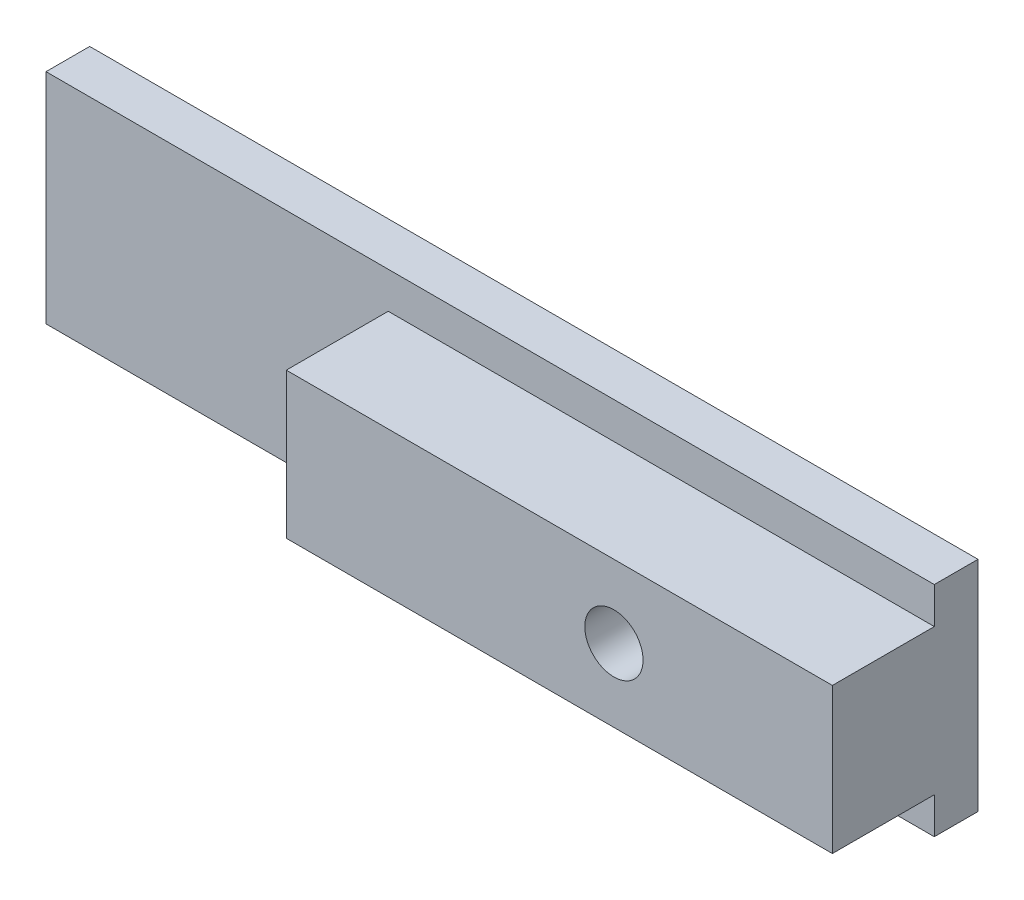
from build123d import *

# Parameters (mm, degrees)
ESTRUSIONE_ESTRUSIONE1_DEPTH = 6
ESTRUSIONE_ESTRUSIONE2_DEPTH = 14
SCHIZZO3_R                   = 3.999999999999999
TAGLIO_ESTRUSIONE1_DEPTH     = 9
FILETTATURA2_PITCH           = 1


with BuildPart() as part:
    # Schizzo1 → Estrusione-Estrusione1 (new body)
    with BuildSketch(Plane.XY):
        Polygon((61, -14.999999999999991), (-61, -15.000000000000005), (-61, 14.999999999999995), (61, 15.000000000000009), align=None)
    extrude(amount=ESTRUSIONE_ESTRUSIONE1_DEPTH)

    # Schizzo2 → Estrusione-Estrusione2 (add)
    with BuildSketch(Plane.XY.offset(6)):
        Polygon((-14.000000000000012, 9.999999999999932), (60.999999999999986, 10.000000000000002), (60.99999999999999, -10.000000000000002), (-14.000000000000012, -9.99999999999998), align=None)
    extrude(amount=ESTRUSIONE_ESTRUSIONE2_DEPTH)

    # Schizzo3 → Taglio-Estrusione1 (cut)
    with BuildSketch(Plane.XY.offset(20)):
        with Locations((30.999999999999993, -3.67e-15)):
            Circle(SCHIZZO3_R)
    extrude(amount=-TAGLIO_ESTRUSIONE1_DEPTH, mode=Mode.SUBTRACT)

    # Schizzo8 → Foro per Vite M8-2 (revolve, cut)
    with BuildSketch(Plane(origin=(30.999999999999993, -3.67e-15, 11.000000000000002), x_dir=(0, -1, 0), z_dir=(1, 0, 0))):
        Polygon((0, 0), (-2.69e-15, 11.000000000000002), (4.2, 11.000000000000002), (4.199999999999989, -1.04e-15), align=None)
    revolve(axis=Axis((30.999999999999993, -3.67e-15, 17.349999999999994), (0, 0, -1)), mode=Mode.SUBTRACT)

    # Filettatura2: the profile of Profilo filettatura2 profile screwed along a right-hand helix of 11 turns, 8 arcs to a turn; built about Z, then put on its axis
    filettatura2_z = Axis((0, 0, 0), (0, 0, 1))
    filettatura2_corners = [(4.1997, 0, -0.000173205), (4.741265875, 0, 0.312499999), (4.741265875, 0, 0.437499999), (4.1997, 0, 0.750173202)]
    with BuildLine(mode=Mode.PRIVATE) as filettatura2_profile:
        Line(filettatura2_corners[0], filettatura2_corners[1])
        Line(filettatura2_corners[1], filettatura2_corners[2])
        Line(filettatura2_corners[2], filettatura2_corners[3])
        Line(filettatura2_corners[3], filettatura2_corners[0])
    filettatura2_cap = Face(filettatura2_profile.wire())
    filettatura2_turn_angles = [0, 22.5, 45, 67.5, 90, 112.5, 135, 157.5, 180, 202.5, 225, 247.5, 270, 292.5, 315, 337.5, 360]
    filettatura2_turn_weights = [1, 0.9238795325112867, 1, 0.9238795325112867, 1, 0.9238795325112867, 1, 0.9238795325112867, 1, 0.9238795325112867, 1, 0.9238795325112867, 1, 0.9238795325112867, 1, 0.9238795325112867, 1]
    filettatura2_turn_rails = [Edge.make_bspline([Vector(p[0], p[1], 0).rotate(filettatura2_z, filettatura2_turn_angles[k]) / filettatura2_turn_weights[k] + Vector(0, 0, p[2] + FILETTATURA2_PITCH * filettatura2_turn_angles[k] / 360) for k in range(17)], [0, 0, 0, 1, 1, 2, 2, 3, 3, 4, 4, 5, 5, 6, 6, 7, 7, 8, 8, 8], 2, filettatura2_turn_weights) for p in filettatura2_corners]
    filettatura2_turn_sides = [Face.make_surface_from_curves(filettatura2_turn_rails[p[0]], filettatura2_turn_rails[p[1]]) for p in [(0, 1), (1, 2), (2, 3), (3, 0)]]
    filettatura2 = Plane(origin=(31, 0, 0), x_dir=(1, 0, 0), z_dir=(0, 0, 1)) * Solid(Shell([*[p.moved(Location((0, 0, FILETTATURA2_PITCH * i))) for i in range(11) for p in filettatura2_turn_sides], filettatura2_cap, filettatura2_cap.rotate(filettatura2_z, 3960).moved(Location((0, 0, FILETTATURA2_PITCH * 3960 / 360)))]))
    add(filettatura2, mode=Mode.SUBTRACT)


solid = part.part
